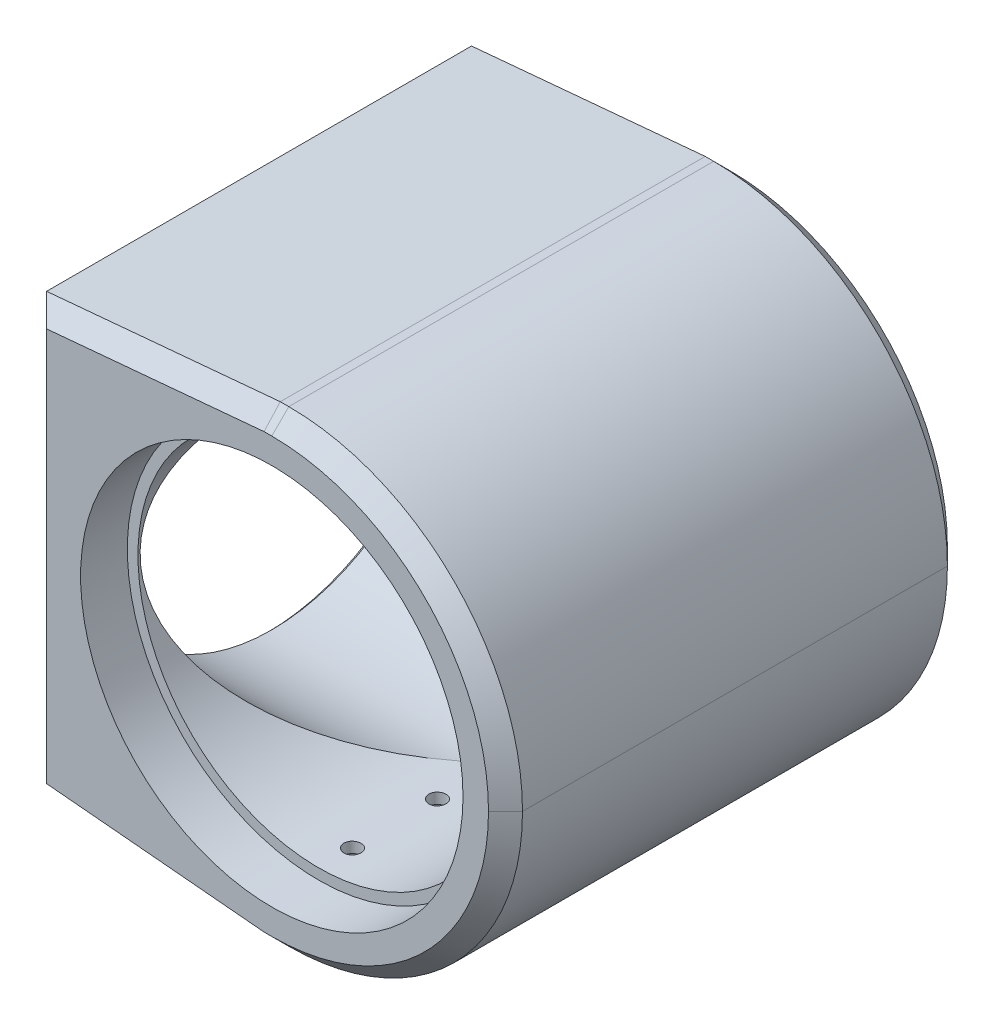
from build123d import *

# Parameters (mm, degrees)
SKETCH_1_W           = 112
SKETCH_1_H           = 110
EXTRUDE_1_DEPTH      = 126
FILLET_1_R           = 55
SKETCH_9_R           = 42.5
CUT_EXTRUDE_5_DEPTH  = 104
SKETCH_10_R          = 42.5
CUT_EXTRUDE_6_DEPTH  = 57
CUT_EXTRUDE_START    = -50
SKETCH_11_R          = 42.5
CUT_EXTRUDE_7_DEPTH  = 50
CHAMFER_1_SIZE       = 55
CHAMFER_1_SIZE2      = 5
CHAMFER_2_SIZE       = 5
CHAMFER_2_SIZE2      = 55
SKETCH_14_W          = 143.089430894
SKETCH_14_H          = 9
CUT_EXTRUDE_8_DEPTH  = 202.295802241
CHAMFER_5_SIZE       = 4
CHAMFER_6_SIZE       = 4
SKETCH_18_R          = 5
CUT_EXTRUDE_9_DEPTH  = 21
SKETCH_19_R          = 45
CUT_EXTRUDE_10_DEPTH = 11
CUT_EXTRUDE_START_2  = -11
SKETCH_20_R          = 45
CUT_EXTRUDE_11_DEPTH = 11
CHAMFER_7_SIZE       = 4
SKETCH_17_R          = 47.5
SKETCH_17_R_2        = 42.5
CUT_EXTRUDE_12_DEPTH = 2
CHAMFER_8_SIZE       = 1
SKETCH_21_R          = 5
CUT_EXTRUDE_13_DEPTH = 10
SKETCH_22_R          = 2
CUT_EXTRUDE_14_DEPTH = 10


# Some blends are built 0.0001 mm under size
with BuildPart() as part:
    # 草图1 → 拉伸1 (new body)
    with BuildSketch(Plane.XY):
        with Locations((56, -55)):
            Rectangle(SKETCH_1_W, SKETCH_1_H)
    extrude(amount=EXTRUDE_1_DEPTH)

    # 圆角1
    fillet_1_edges = [part.edges().sort_by_distance(p)[0] for p in [
        (112, -110, 63),
        (112, 0, 63),
    ]]
    fillet(fillet_1_edges, radius=FILLET_1_R - 0.0001)  # a hair under: the kernel refuses the full size

    # 草图9 → 切除-拉伸5 (cut)
    with BuildSketch(Plane.XY.offset(126)):
        with Locations((57, -55)):
            Circle(SKETCH_9_R)
    extrude(amount=-CUT_EXTRUDE_5_DEPTH, mode=Mode.SUBTRACT)

    # 草图10 → 切除-拉伸6 (cut)
    with BuildSketch(Plane.ZY):
        with Locations(Location((63, -55, 0), (0, 0, 270))):
            Circle(SKETCH_10_R)
    extrude(amount=-CUT_EXTRUDE_6_DEPTH, mode=Mode.SUBTRACT)

    # 草图11 → 切除-拉伸7 (cut)
    with BuildSketch(Plane(origin=(0, 0, 0), x_dir=(-1, 0, 0), z_dir=(0, 0, -1)).offset(CUT_EXTRUDE_START)):
        with Locations(Location((-57, -55, 0), (0, 0, 180))):
            Circle(SKETCH_11_R)
    extrude(amount=CUT_EXTRUDE_7_DEPTH, mode=Mode.SUBTRACT)

    # 倒角1
    chamfer_1_edges = [part.edges().sort_by_distance(p)[0] for p in [
        (0, 0, 63),
    ]]
    chamfer_1_side = [part.faces().sort_by_distance(p)[0] for p in [
        (28.50005, 0, 63),
    ]]
    chamfer(chamfer_1_edges, length=CHAMFER_1_SIZE, length2=CHAMFER_1_SIZE2, reference=chamfer_1_side[0])

    # 倒角2
    chamfer_2_edges = [part.edges().sort_by_distance(p)[0] for p in [
        (0, -110, 63),
    ]]
    chamfer_2_side = [part.faces().sort_by_distance(p)[0] for p in [
        (0, -57.5, 1.640152432),
    ]]
    chamfer(chamfer_2_edges, length=CHAMFER_2_SIZE, length2=CHAMFER_2_SIZE2, reference=chamfer_2_side[0])

    # 草图14 → 切除-拉伸8 (cut, through all)
    with BuildSketch(Plane(origin=(0, 0, 0), x_dir=(1, 0, 0), z_dir=(0, 1, 0))):
        with Locations((58.317073171, -4.5)):
            Rectangle(SKETCH_14_W, SKETCH_14_H)
        with Locations((58.317073171, -121.5)):
            Rectangle(SKETCH_14_W, SKETCH_14_H)
    extrude(amount=-CUT_EXTRUDE_8_DEPTH, mode=Mode.SUBTRACT)

    # 倒角5
    chamfer_5_edges = [part.edges().sort_by_distance(p)[0] for p in [
        (0, -55, 117),
    ]]
    chamfer(chamfer_5_edges, length=CHAMFER_5_SIZE)

    # 倒角6
    chamfer_6_edges = [part.edges().sort_by_distance(p)[0] for p in [
        (0, -55, 9),
    ]]
    chamfer(chamfer_6_edges, length=CHAMFER_6_SIZE)

    # 草图18 → 切除-拉伸9 (cut)
    with BuildSketch(Plane.ZY):
        with Locations((23, -15)):
            Circle(SKETCH_18_R)
        with Locations((103, -15)):
            Circle(SKETCH_18_R)
        with Locations((23, -95)):
            Circle(SKETCH_18_R)
        with Locations((103, -95)):
            Circle(SKETCH_18_R)
    extrude(amount=-CUT_EXTRUDE_9_DEPTH, mode=Mode.SUBTRACT)

    # 草图19 → 切除-拉伸10 (cut)
    with BuildSketch(Plane.XY.offset(117)):
        with Locations((57, -55)):
            Circle(SKETCH_19_R)
    extrude(amount=-CUT_EXTRUDE_10_DEPTH, mode=Mode.SUBTRACT)

    # 草图20 → 切除-拉伸11 (cut)
    with BuildSketch(Plane(origin=(0, 0, 9), x_dir=(-1, 0, 0), z_dir=(0, 0, -1)).offset(CUT_EXTRUDE_START_2)):
        with Locations(Location((-57, -55, 0), (0, 0, 180))):
            Circle(SKETCH_20_R)
    extrude(amount=CUT_EXTRUDE_11_DEPTH, mode=Mode.SUBTRACT)

    # 倒角7
    # the kernel refuses this chamfer: 4 mm, written as the material it takes off along each edge
    with BuildSketch(Plane(origin=(-6.244486468, -104.432319412, 117), x_dir=(-0.002489359702032544, -0.027382956722357982, -0.9996219169112968), z_dir=(0.9958932064677039, -0.09053574604251853, 0)), Plane(origin=(65.244486468, 0.931316952, 117), x_dir=(-0.002489359702032457, 0.027382956722357025, -0.9996219169112968), z_dir=(-0.9958932064677039, -0.09053574604251853, 0))) as chamfer_7_piece_1:
        Polygon((CHAMFER_7_SIZE * 0.999621916911, CHAMFER_7_SIZE * 0.0274958766106), (-CHAMFER_7_SIZE * 0.0274958766106, CHAMFER_7_SIZE * 0.999621916911), (0, 0), align=None)
    extrude(amount=71.783774074, mode=Mode.SUBTRACT)
    with BuildSketch(Plane(origin=(57.0001, -110, 117), x_dir=(0, 0.9996219169112968, 0.027495876610585647), z_dir=(-1, 0, 0)), Plane(origin=(44.713268048, 0, 117), x_dir=(0, -0.9996219169112968, 0.02749587661058563), z_dir=(1, 0, 0))) as chamfer_7_piece_2:
        Polygon((CHAMFER_7_SIZE * 0.999621916911, CHAMFER_7_SIZE * 0.0274958766106), (-CHAMFER_7_SIZE * 0.0274958766106, CHAMFER_7_SIZE * 0.999621916911), (0, 0), align=None)
    extrude(amount=12.286831952, mode=Mode.SUBTRACT)
    with BuildSketch(Plane(origin=(57.0001, -55.0001, 117), x_dir=(0, -1, 0), z_dir=(-1, 0, 0))) as chamfer_7_piece_3:
        Polygon((54.9999 - CHAMFER_7_SIZE, 0), (54.9999, -CHAMFER_7_SIZE), (54.9999, 0), align=None)
    revolve(axis=Axis((57.0001, -55.0001, 117), (0, 0, 1)), revolution_arc=90, mode=Mode.SUBTRACT)
    with BuildSketch(Plane(origin=(57.0001, -54.9999, 117), x_dir=(1, 0, 0), z_dir=(0, -1, 0))) as chamfer_7_piece_4:
        Polygon((54.9999 - CHAMFER_7_SIZE, 0), (54.9999, -CHAMFER_7_SIZE), (54.9999, 0), align=None)
    revolve(axis=Axis((57.0001, -54.9999, 117), (0, 0, 1)), revolution_arc=90, mode=Mode.SUBTRACT)
    with BuildSketch(Plane(origin=(-6.244486468, -104.432319412, 9), x_dir=(-0.002489359702032431, -0.027382956722357972, 0.9996219169112968), z_dir=(0.9958932064677039, -0.09053574604251853, 0)), Plane(origin=(65.244486468, 0.931316952, 9), x_dir=(-0.0024893597020323437, 0.02738295672235701, 0.9996219169112968), z_dir=(-0.9958932064677039, -0.09053574604251853, 0))) as chamfer_7_piece_5:
        Polygon((CHAMFER_7_SIZE * 0.999621916911, -CHAMFER_7_SIZE * 0.0274958766106), (-CHAMFER_7_SIZE * 0.0274958766106, -CHAMFER_7_SIZE * 0.999621916911), (0, 0), align=None)
    extrude(amount=71.783774074, mode=Mode.SUBTRACT)
    with BuildSketch(Plane(origin=(44.713268048, 0, 9), x_dir=(0, -0.9996219169112968, -0.027495876610586494), z_dir=(1, 0, 0)), Plane(origin=(57.0001, -110, 9), x_dir=(0, 0.9996219169112968, -0.02749587661058651), z_dir=(-1, 0, 0))) as chamfer_7_piece_6:
        Polygon((CHAMFER_7_SIZE * 0.999621916911, -CHAMFER_7_SIZE * 0.0274958766106), (-CHAMFER_7_SIZE * 0.0274958766106, -CHAMFER_7_SIZE * 0.999621916911), (0, 0), align=None)
    extrude(amount=12.286831952, mode=Mode.SUBTRACT)
    with BuildSketch(Plane(origin=(57.0001, -54.9999, 9), x_dir=(1, 0, 0), z_dir=(0, -1, 0))) as chamfer_7_piece_7:
        Polygon((54.9999 - CHAMFER_7_SIZE, 0), (54.9999, CHAMFER_7_SIZE), (54.9999, 0), align=None)
    revolve(axis=Axis((57.0001, -54.9999, 9), (0, 0, 1)), revolution_arc=90, mode=Mode.SUBTRACT)
    with BuildSketch(Plane(origin=(57.0001, -55.0001, 9), x_dir=(0, -1, 0), z_dir=(-1, 0, 0))) as chamfer_7_piece_8:
        Polygon((54.9999 - CHAMFER_7_SIZE, 0), (54.9999, CHAMFER_7_SIZE), (54.9999, 0), align=None)
    revolve(axis=Axis((57.0001, -55.0001, 9), (0, 0, 1)), revolution_arc=90, mode=Mode.SUBTRACT)
    with BuildSketch(Plane(origin=(112, -54.9999, 9), x_dir=(-0.9996219169112968, 0, -0.02749587661058651), z_dir=(0, -1, 0))) as chamfer_7_piece_9:
        Polygon((CHAMFER_7_SIZE * 0.999621916911, -CHAMFER_7_SIZE * 0.0274958766106), (-CHAMFER_7_SIZE * 0.0274958766106, -CHAMFER_7_SIZE * 0.999621916911), (0, 0), align=None)
    extrude(amount=0.0002, mode=Mode.SUBTRACT)
    with BuildSketch(Plane(origin=(112, -54.9999, 117), x_dir=(-0.9996219169112968, 0, 0.027495876610585647), z_dir=(0, -1, 0))) as chamfer_7_piece_10:
        Polygon((CHAMFER_7_SIZE * 0.999621916911, CHAMFER_7_SIZE * 0.0274958766106), (-CHAMFER_7_SIZE * 0.0274958766106, CHAMFER_7_SIZE * 0.999621916911), (0, 0), align=None)
    extrude(amount=0.0002, mode=Mode.SUBTRACT)

    # 草图17 → 切除-拉伸12 (cut)
    with BuildSketch(Plane.ZY):
        with Locations(Location((63, -55, 0), (0, 0, 270))):
            Circle(SKETCH_17_R)
        with Locations(Location((63, -55, 0), (0, 0, 270))):
            Circle(SKETCH_17_R_2, mode=Mode.SUBTRACT)
    extrude(amount=-CUT_EXTRUDE_12_DEPTH, mode=Mode.SUBTRACT)

    # 倒角8
    chamfer_8_edges = [part.edges().sort_by_distance(p)[0] for p in [
        (2, -12.5, 63),
    ]]
    chamfer(chamfer_8_edges, length=CHAMFER_8_SIZE)

    # 草图21 → 切除-拉伸13 (cut)
    with BuildSketch(Plane.XZ.offset(110)):
        with Locations(Location((57, 98, 0), (0, 0, 270))):
            Circle(SKETCH_21_R)
        with Locations(Location((57, 78, 0), (0, 0, 90))):
            Circle(SKETCH_21_R)
    extrude(amount=-CUT_EXTRUDE_13_DEPTH, mode=Mode.SUBTRACT)

    # 草图22 → 切除-拉伸14 (cut)
    with BuildSketch(Plane.XZ.offset(100)):
        with Locations(Location((57, 78, 0), (0, 0, 270))):
            Circle(SKETCH_22_R)
        with Locations(Location((57, 98, 0), (0, 0, 270))):
            Circle(SKETCH_22_R)
    extrude(amount=-CUT_EXTRUDE_14_DEPTH, mode=Mode.SUBTRACT)


solid = part.part
